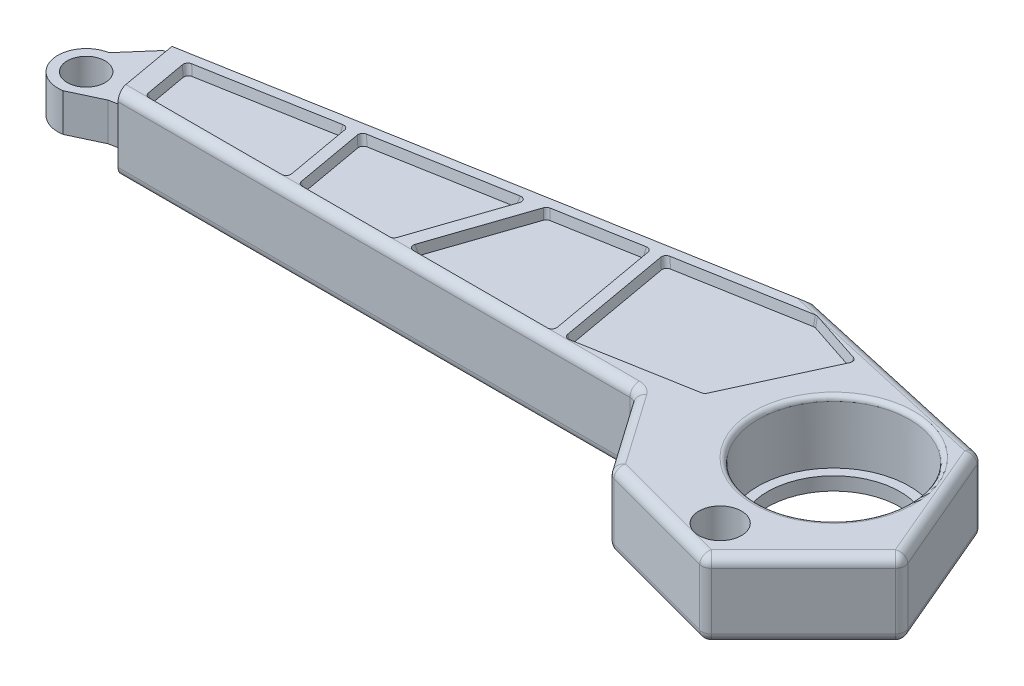
from build123d import *
from OCP.BRepFilletAPI import BRepFilletAPI_MakeChamfer

# Parameters (mm, degrees)
BOSS_EXTRUDE1_DEPTH = 8
SKETCH4_R           = 2.249999999999996
CUT_EXTRUDE1_DEPTH  = 92.98394802222327
FILLET1_R           = 1
FILLET2_R           = 1
FILLET4_R           = 1
SKETCH9_W           = 0.9999999999999964
SKETCH9_H           = 8
CUT_EXTRUDE5_DEPTH  = 0.3
CUT_EXTRUDE6_DEPTH  = 92.80461337567392
BOSS_EXTRUDE2_DEPTH = 5
SKETCH12_R          = 3
BOSS_EXTRUDE3_DEPTH = 4
SKETCH13_R          = 2
CUT_EXTRUDE7_DEPTH  = 92.65198872396041
SKETCH14_R          = 0.4999999999999998
CUT_EXTRUDE8_DEPTH  = 2
CUT_EXTRUDE9_DEPTH  = 92.65198872396041
CUT_EXTRUDE10_DEPTH = 92.65198872396041
CUT_EXTRUDE12_DEPTH = 92.65198872396041
BOSS_EXTRUDE4_DEPTH = 4
BOSS_EXTRUDE5_START = -1
SKETCH20_R          = 2
SKETCH20_R_2        = 1.5
BOSS_EXTRUDE5_DEPTH = 1
SKETCH21_R          = 7.9999999999999964
CUT_EXTRUDE13_DEPTH = 6.6
SKETCH22_R          = 7.000000000000001
CUT_EXTRUDE14_DEPTH = 92.69322241614681
FILLET5_R           = 0.5
CHAMFER1_SIZE       = 3
CUT_EXTRUDE15_DEPTH = 1
CUT_EXTRUDE18_DEPTH = 1
CHAMFER3_SIZE       = 1
CHAMFER3_SIZE_2     = 0.176326981
FILLET6_R           = 0.5
CUT_EXTRUDE16_DEPTH = 1
CUT_EXTRUDE17_DEPTH = 1
CHAMFER4_SIZE       = 1
CHAMFER4_SIZE_2     = 0.176326981
FILLET7_R           = 0.5
FILLET8_R           = 1


# Some blends are built 0.0001 mm under size
with BuildPart() as part:
    # Sketch3 → Boss-Extrude1 (new body)
    with BuildSketch(Plane(origin=(0, 0, 0), x_dir=(1, 0, 0), z_dir=(0, 1, 0))):
        Polygon((0, 0), (60.00000000000001, 0), (65.73576436351047, -8.191520442889912), (79.02230127440997, -11.751637278371739), (89.6289029922082, -1.1450355605735398), (83.7679360648691, 12.662537241213071), (55.20005539838964, 19.071089171004548), (-13.712430259028462, 6.780063155405024), (-15.782982619848628, -0.9473434549075227), (-1.2940952255126068, -4.829629131445341), align=None)
    extrude(amount=BOSS_EXTRUDE1_DEPTH)

    # Sketch4 → Cut-Extrude1 (cut, through all)
    with BuildSketch(Plane(origin=(0, 8, 0), x_dir=(1, 0, 0), z_dir=(0, 1, 0))):
        with Locations(Location((76.77230127440997, -7.7516372783717395, 0), (0, 0, 270))):
            Circle(SKETCH4_R)
    extrude(amount=-CUT_EXTRUDE1_DEPTH, mode=Mode.SUBTRACT)

    # Fillet1
    fillet1_edges = [part.edges().sort_by_distance(p)[0] for p in [
        (83.7679360648691, 4, -12.662537241213071),
        (89.6289029922082, 4, 1.1450355605735398),
        (79.02230127440997, 4, 11.751637278371739),
    ]]
    fillet(fillet1_edges, radius=FILLET1_R)

    # Fillet2
    fillet2_edges = [part.edges().sort_by_distance(p)[0] for p in [
        (65.73576436351047, 4, 8.191520442889912),
        (60.00000000000001, 4, 0),
        (0, 4, 0),
    ]]
    fillet(fillet2_edges, radius=FILLET2_R)

    # Fillet4
    fillet4_edges = [part.edges().sort_by_distance(p)[0] for p in [
        (-13.712430259028462, 4, -6.780063155405024),
    ]]
    fillet(fillet4_edges, radius=FILLET4_R)

    # Sketch9 → Cut-Extrude5 (cut)
    with BuildSketch(Plane(origin=(-1.2940952255126068, 0, 4.829629131445342), x_dir=(0.9659258262890682, 0, 0.2588190451025213), z_dir=(-0.2588190451025213, 0, 0.9659258262890682))):
        Polygon((-14.000000000000002, 8), (-13.000000000000004, 8), (-13.000000000000002, 0), (-14.000000000000002, 0), align=None)
        with Locations((-11.500000000000002, 4)):
            Rectangle(SKETCH9_W, SKETCH9_H)
        Polygon((-10.000000000000002, 8), (-9.000000000000004, 8), (-9.000000000000002, 0), (-10, 0), align=None)
        Polygon((-6.0000000000000036, 8), (-5.000000000000003, 8), (-5.000000000000002, 0), (-6.000000000000002, 0), align=None)
        Polygon((-4.000000000000002, 8), (-3.0000000000000027, 8), (-3.0000000000000018, 0), (-4.000000000000002, 0), align=None)
        Polygon((-2.0000000000000036, 8), (-1.0000000000000027, 8), (-1.0000000000000018, 0), (-2.0000000000000018, 0), align=None)
        Polygon((-8.000000000000004, 8), (-7.000000000000003, 8), (-7.000000000000002, 0), (-8.000000000000002, 0), align=None)
    extrude(amount=-CUT_EXTRUDE5_DEPTH, mode=Mode.SUBTRACT)

    # Sketch10 → Cut-Extrude6 (cut, through all)
    with BuildSketch(Plane(origin=(0, 8, 0), x_dir=(1, 0, 0), z_dir=(0, 1, 0))):
        Polygon((3.6492707822654706, 9.876644524337756), (5.4108397292767005, 0), (6.584389621055377, -6.579779424664859), (-13.988533836457151, -10.790968007498236), (-17.448835921663886, 6.11364895243188), align=None)
    extrude(amount=-CUT_EXTRUDE6_DEPTH, mode=Mode.SUBTRACT)

    # Sketch11 → Boss-Extrude2 (add)
    with BuildSketch(Plane(origin=(5.244020977986171, 0, -0.9353079873971974), x_dir=(0.1755860859371368, 0, 0.9844640808202585), z_dir=(-0.9844640808202585, 0, 0.1755860859371368))):
        Polygon((-9.082440600057861, 6), (0.9500681696968528, 6), (0.9500681696968527, 2), (-9.082440600057861, 2), align=None)
    extrude(amount=BOSS_EXTRUDE2_DEPTH)

    # Sketch12 → Boss-Extrude3 (add)
    with BuildSketch(Plane(origin=(0, 6, 0), x_dir=(1, 0, 0), z_dir=(0, 1, 0))):
        with Locations((-0.03823893263600218, 2.0754618127750915)):
            Circle(SKETCH12_R)
    extrude(amount=-BOSS_EXTRUDE3_DEPTH)

    # Sketch13 → Cut-Extrude7 (cut, through all)
    with BuildSketch(Plane(origin=(0, 6, 0), x_dir=(1, 0, 0), z_dir=(0, 1, 0))):
        with Locations(Location((-0.03823893263600218, 2.0754618127750915, 0), (0, 0, 270))):
            Circle(SKETCH13_R)
    extrude(amount=-CUT_EXTRUDE7_DEPTH, mode=Mode.SUBTRACT)

    # Sketch14 → Cut-Extrude8 (cut)
    with BuildSketch(Plane(origin=(5.244020977986171, 0, -0.9353079873971974), x_dir=(0.1755860859371368, 0, 0.9844640808202585), z_dir=(-0.9844640808202585, 0, 0.1755860859371368))):
        with Locations((-7.78244060005786, 7)):
            Circle(SKETCH14_R)
    extrude(amount=-CUT_EXTRUDE8_DEPTH, mode=Mode.SUBTRACT)

    # Sketch15 → Cut-Extrude9 (cut, through all)
    with BuildSketch(Plane(origin=(0, 6, 0), x_dir=(1, 0, 0), z_dir=(0, 1, 0))):
        Polygon((-0.5649971904474126, 5.028854055235867), (3.6492707822654706, 9.876644524337756), (-1.2730496218358216, 8.998714094652073), align=None)
    extrude(amount=-CUT_EXTRUDE9_DEPTH, mode=Mode.SUBTRACT)

    # Sketch16 → Cut-Extrude10 (cut, through all)
    with BuildSketch(Plane(origin=(0, 6, 0), x_dir=(1, 0, 0), z_dir=(0, 1, 0))):
        Polygon((0.4885193251754081, -0.877930429685684), (5.175598979631719, 1.3189317771661455), (5.4108397292767005, 0), align=None)
    extrude(amount=-CUT_EXTRUDE10_DEPTH, mode=Mode.SUBTRACT)

    # Sketch17 → Cut-Extrude12 (cut, through all)
    with BuildSketch(Plane(origin=(0, 6, 0), x_dir=(1, 0, 0), z_dir=(0, 1, 0))):
        Polygon((3.9126499111711754, 8.399948403107368), (2.081660562423631, 8.073378587709637), (3.6492707822654706, 9.876644524337756), align=None)
    extrude(amount=-CUT_EXTRUDE12_DEPTH, mode=Mode.SUBTRACT)

    # Sketch19 → Boss-Extrude4 (add)
    with BuildSketch(Plane(origin=(0, 6, 0), x_dir=(1, 0, 0), z_dir=(0, 1, 0))):
        Polygon((5.24362235052317, 0.9375429846457439), (3.7216638547456102, 0.6374637069489362), (5.175598979631719, 1.3189317771661455), align=None)
    extrude(amount=-BOSS_EXTRUDE4_DEPTH)

    # Sketch20 → Boss-Extrude5 (add)
    with BuildSketch(Plane.XZ.offset(-2).offset(BOSS_EXTRUDE5_START)):
        with Locations(Location((-0.03823893263600218, -2.0754618127750915, 0), (0, 0, 90))):
            Circle(SKETCH20_R)
        with Locations(Location((-0.03823893263600218, -2.0754618127750915, 0), (0, 0, 270))):
            Circle(SKETCH20_R_2, mode=Mode.SUBTRACT)
    extrude(amount=BOSS_EXTRUDE5_DEPTH)

    # Sketch21 → Cut-Extrude13 (cut)
    with BuildSketch(Plane(origin=(0, 8, 0), x_dir=(1, 0, 0), z_dir=(0, 1, 0))):
        with Locations(Location((76.77230127440997, 4.248362721628261, 0), (0, 0, 270))):
            Circle(SKETCH21_R)
    extrude(amount=-CUT_EXTRUDE13_DEPTH, mode=Mode.SUBTRACT)

    # Sketch22 → Cut-Extrude14 (cut, through all)
    with BuildSketch(Plane(origin=(0, 1.4000000000000001, 0), x_dir=(1, 0, 0), z_dir=(0, 1, 0))):
        with Locations(Location((76.77230127440997, 4.248362721628261, 0), (0, 0, 270))):
            Circle(SKETCH22_R)
    extrude(amount=-CUT_EXTRUDE14_DEPTH, mode=Mode.SUBTRACT)

    # Fillet5
    fillet5_edges = [part.edges().sort_by_distance(p)[0] for p in [
        (76.77230127440997, 8, -12.248362721628258),
    ]]
    fillet(fillet5_edges, radius=FILLET5_R)

    # Chamfer1
    chamfer1_edges = [part.edges().sort_by_distance(p)[0] for p in [
        (29.424663090327552, 0, -14.473866847671154),
        (29.424663090327552, 8, -14.473866847671154),
    ]]
    chamfer(chamfer1_edges, length=CHAMFER1_SIZE)

    # Sketch23 → Cut-Extrude15 (cut)
    with BuildSketch(Plane(origin=(0, 8, 0), x_dir=(1, 3e-17, 0), z_dir=(-3e-17, 1, 6e-17))):
        Polygon((6.320543287654537, 6.289960372931009), (7.264044888923313, 1), (22.264044888923312, 1.0000000000000002), (20.85808618403368, 8.882833293384943), align=None)
    extrude(amount=-CUT_EXTRUDE15_DEPTH, mode=Mode.SUBTRACT)

    # Sketch26 → Cut-Extrude18 (cut)
    with BuildSketch(Plane.XZ):
        Polygon((7.264044888923271, -1.0000000000000144), (22.264044888923273, -1.0000000000000144), (20.85808618403371, -8.882833293384953), (6.320543287654537, -6.2899603729310085), align=None)
    extrude(amount=-CUT_EXTRUDE18_DEPTH, mode=Mode.SUBTRACT)

    # Chamfer3
    chamfer3_edges_1 = [part.edges().sort_by_distance(p)[0] for p in [
        (21.561065536478495, 7.000000000000001, -4.941416646692471),
    ]]
    chamfer3_side_1 = [part.faces().sort_by_distance(p)[0] for p in [
        (21.561065536478495, 7.00352653961417, -4.941416646692471),
    ]]
    chamfer3_edges_2 = [part.edges().sort_by_distance(p)[0] for p in [
        (14.764044888923312, 7.000000000000001, -1),
    ]]
    chamfer3_side_2 = [part.faces().sort_by_distance(p)[0] for p in [
        (14.764044888923312, 7.00352653961417, -1),
    ]]
    chamfer3_edges_3 = [part.edges().sort_by_distance(p)[0] for p in [
        (6.792294088288925, 7, -3.6449801864655047),
    ]]
    chamfer3_side_3 = [part.faces().sort_by_distance(p)[0] for p in [
        (6.792294088288925, 7.003526539614169, -3.6449801864655047),
    ]]
    chamfer3_edges_4 = [part.edges().sort_by_distance(p)[0] for p in [
        (13.589314735844109, 7.000000000000001, -7.586396833157976),
    ]]
    chamfer3_side_4 = [part.faces().sort_by_distance(p)[0] for p in [
        (13.589314735844109, 7.00352653961417, -7.586396833157976),
    ]]
    chamfer3 = BRepFilletAPI_MakeChamfer(part.part.solid().wrapped)
    for e in chamfer3_edges_1:
        chamfer3.Add(CHAMFER3_SIZE - 0.0001, CHAMFER3_SIZE_2 - 0.0001, e.wrapped, chamfer3_side_1[0].wrapped)
    for e in chamfer3_edges_2:
        chamfer3.Add(CHAMFER3_SIZE - 0.0001, CHAMFER3_SIZE_2 - 0.0001, e.wrapped, chamfer3_side_2[0].wrapped)
    for e in chamfer3_edges_3:
        chamfer3.Add(CHAMFER3_SIZE - 0.0001, CHAMFER3_SIZE_2 - 0.0001, e.wrapped, chamfer3_side_3[0].wrapped)
    for e in chamfer3_edges_4:
        chamfer3.Add(CHAMFER3_SIZE - 0.0001, CHAMFER3_SIZE_2 - 0.0001, e.wrapped, chamfer3_side_4[0].wrapped)
    add(Compound.cast(chamfer3.Shape()), mode=Mode.REPLACE)  # a hair under: the kernel refuses the full size

    # Fillet6
    # the kernel refuses this fillet: 0.5 mm, written as the material it adds along each edge
    with BuildSketch(Plane(origin=(6.823821238566845, 10.98261734621967, -0.4743121581151881), x_dir=(-0.19833848791101824, 0.1416565118206084, -0.9698429135030007), z_dir=(0.14383976600970688, -0.97458045428937, -0.1717645476557896))) as fillet6_piece_1_section:
        with BuildLine():
            CenterArc((FILLET6_R * 0.81613712734, FILLET6_R), FILLET6_R, 191.56167759348406, 78.43832240651591)
            Line((-FILLET6_R * 0.163572394541, FILLET6_R * 0.799577314815), (0, 0))
            Line((0, 0), (FILLET6_R * 0.81613712734, 0))
        make_face()
    fillet6_piece_1 = extrude(amount=5.106665580785913, mode=Mode.PRIVATE)
    fillet6_piece_1 = split(fillet6_piece_1, bisect_by=Plane(origin=(6.823821238566845, 8, -0.4743121581151881), z_dir=(0, -1, 0)), keep=Keep.TOP, mode=Mode.PRIVATE)
    add(fillet6_piece_1)
    with BuildSketch(Plane(origin=(5.598690700329794, 11.530560133329704, -6.793292634042218), x_dir=(0.14377807070550067, 0.1684169241381096, 0.9751736286672554), z_dir=(0.1983832161669965, -0.9703140568331037, 0.13832834364411134))) as fillet6_piece_2_section:
        with BuildLine():
            CenterArc((FILLET6_R * 0.970314056833, -FILLET6_R), FILLET6_R, 90.00000000000018, 88.27362489281286)
            Line((-FILLET6_R * 0.0292320410453, -FILLET6_R * 0.969873629224), (0, 0))
            Line((0, 0), (FILLET6_R * 0.970314056833, 0))
        make_face()
    fillet6_piece_2 = extrude(amount=5.882061384401134, mode=Mode.PRIVATE)
    fillet6_piece_2 = split(fillet6_piece_2, bisect_by=Plane(origin=(5.598690700329794, 8, -6.793292634042218), z_dir=(0, -1, 0)), keep=Keep.TOP, mode=Mode.PRIVATE)
    add(fillet6_piece_2)
    with BuildSketch(Plane(origin=(23.140448314746898, 12.164120056491484, -0.2660786790927667), x_dir=(-0.9791885925249815, 0.1998719692365431, 0.03522635636071799), z_dir=(-0.20295245814955268, -0.9643260989611157, -0.16995727284670917))) as fillet6_piece_3_section:
        with BuildLine():
            CenterArc((FILLET6_R * 1.15153855415, FILLET6_R), FILLET6_R, 171.94231973122922, 98.05768026877081)
            Line((FILLET6_R * 0.161411094227, FILLET6_R * 1.14016994363), (0, 0))
            Line((0, 0), (FILLET6_R * 1.15153855415, 0))
        make_face()
    fillet6_piece_3 = extrude(amount=6.794582678737095, mode=Mode.PRIVATE)
    fillet6_piece_3 = split(fillet6_piece_3, bisect_by=Plane(origin=(23.140448314746898, 8, -0.2660786790927667), z_dir=(0, -1, 0)), keep=Keep.TOP, mode=Mode.PRIVATE)
    add(fillet6_piece_3)
    with BuildSketch(Plane(origin=(21.36141844514488, 11.53056013332969, -9.604685880709683), x_dir=(-0.9751736286672563, 0.16841692413810702, 0.1437780707054983), z_dir=(-0.13832834364410923, -0.970314056833104, 0.19838321616699628))) as fillet6_piece_4_section:
        with BuildLine():
            CenterArc((FILLET6_R * 0.970314056833, -FILLET6_R), FILLET6_R, 90.00000000000028, 88.27362489281248)
            Line((-FILLET6_R * 0.0292320410453, -FILLET6_R * 0.969873629224), (0, 0))
            Line((0, 0), (FILLET6_R * 0.970314056833, 1e-17))
        make_face()
    fillet6_piece_4 = extrude(amount=5.8820613844011085, mode=Mode.PRIVATE)
    fillet6_piece_4 = split(fillet6_piece_4, bisect_by=Plane(origin=(21.36141844514488, 8, -9.604685880709683), z_dir=(0, -1, 0)), keep=Keep.TOP, mode=Mode.PRIVATE)
    add(fillet6_piece_4)

    # Sketch24 → Cut-Extrude16 (cut)
    with BuildSketch(Plane(origin=(0, 8, 0), x_dir=(1, 3e-17, 0), z_dir=(-3e-17, 1, 6e-17))):
        Polygon((21.99537218876625, 9.08567624322187), (23.437509358991175, 1.0000000000000144), (33.43750935899117, 1.0000000000000144), (37.09756611667351, 11.779258642546566), align=None)
        Polygon((38.66106910050321, 12.058120385326404), (34.906325886176084, 1.000000000000014), (50.336837418826605, 1.0000000000000144), (48.065381225675125, 13.735445530205476), align=None)
        Polygon((49.20110932225087, 13.938010616176326), (51.508694421764794, 1.0000000000000142), (64.08422154015777, 3.2429336207728054), (69.15274319259933, 14.294082857400431), (62.84910626589879, 16.372226765759397), align=None)
    extrude(amount=-CUT_EXTRUDE16_DEPTH, mode=Mode.SUBTRACT)

    # Sketch25 → Cut-Extrude17 (cut)
    with BuildSketch(Plane.XZ):
        Polygon((23.437509358991175, -1.0000000000000144), (21.99537218876625, -9.08567624322187), (37.09756611667351, -11.779258642546566), (33.43750935899117, -1.0000000000000144), align=None)
        Polygon((34.906325886176084, -1.000000000000014), (38.66106910050321, -12.058120385326404), (48.065381225675125, -13.735445530205476), (50.336837418826605, -1.0000000000000144), align=None)
        Polygon((51.508694421764794, -1.0000000000000142), (49.20110932225087, -13.938010616176326), (62.84910626589879, -16.372226765759397), (69.15274319259933, -14.294082857400431), (64.08422154015777, -3.2429336207728054), align=None)
    extrude(amount=-CUT_EXTRUDE17_DEPTH, mode=Mode.SUBTRACT)

    # Chamfer4
    # the kernel refuses this chamfer: 1, 0.176326981 mm, written as the material it adds along each edge
    with BuildSketch(Plane(origin=(37.93304197923928, 1.000000000000002, -14.239824422926374), x_dir=(5.6e-16, -1, 1.2e-16), z_dir=(-0.32151756353086314, 0, 0.9469036151273146))) as chamfer4_piece_1_section:
        Polygon((CHAMFER4_SIZE, 0), (-1e-16, -CHAMFER4_SIZE_2 * 0.999999998347), (0, 0), align=None)
    chamfer4_piece_1 = extrude(amount=16.580769100976763, mode=Mode.PRIVATE)
    chamfer4_piece_1 = split(chamfer4_piece_1, bisect_by=Plane(origin=(37.93304197923928, 1.000000000000001, -1.0000000000000142), z_dir=(0, 6e-17, -1)), keep=Keep.TOP, mode=Mode.PRIVATE)
    chamfer4_piece_1 = split(chamfer4_piece_1, bisect_by=Plane(origin=(38.33261282146562, 1.0000000000000018, -11.999537900133411), z_dir=(0.1755860859371357, 0, 0.9844640808202587)), keep=Keep.TOP, mode=Mode.PRIVATE)
    add(chamfer4_piece_1)
    with BuildSketch(Plane(origin=(21.99537218876625, 1.000000000000001, -9.08567624322187), x_dir=(-1.6e-16, -1, -1.11e-15), z_dir=(0.9844640808202587, 0, -0.1755860859371357))) as chamfer4_piece_2:
        Polygon((CHAMFER4_SIZE, 0), (-2e-16, -CHAMFER4_SIZE_2 * 0.999999998347), (0, 0), align=None)
    extrude(amount=17.93906185067429)
    with BuildSketch(Plane(origin=(23.89377661541057, 1.0000000000000007, 1.5581681076945575), x_dir=(-1e-17, -1, -5e-17), z_dir=(-0.17558608593713568, 0, -0.9844640808202587))) as chamfer4_piece_3_section:
        Polygon((CHAMFER4_SIZE, 0), (-2.2e-16, -CHAMFER4_SIZE_2 * 0.999999998347), (0, 0), align=None)
    chamfer4_piece_3 = extrude(amount=10.811815848119053, mode=Mode.PRIVATE)
    chamfer4_piece_3 = split(chamfer4_piece_3, bisect_by=Plane(origin=(23.89377661541057, 1.0000000000000009, -1.0000000000000142), z_dir=(0, 6e-17, -1)), keep=Keep.TOP, mode=Mode.PRIVATE)
    add(chamfer4_piece_3)
    with BuildSketch(Plane(origin=(36.03604815541237, 1.000000000000001, -1.0000000000000144), x_dir=(3e-17, -1, 0), z_dir=(-1, -3e-17, 0))) as chamfer4_piece_4_section:
        Polygon((CHAMFER4_SIZE, 0), (-2.2e-16, -CHAMFER4_SIZE_2 * 0.999999998347), (0, 0), align=None)
    chamfer4_piece_4 = extrude(amount=15.197077592842383, mode=Mode.PRIVATE)
    chamfer4_piece_4 = split(chamfer4_piece_4, bisect_by=Plane(origin=(23.82592827643436, 1.0000000000000007, 1.1777606721685763), z_dir=(0.9844640808202587, 0, -0.17558608593713568)), keep=Keep.TOP, mode=Mode.PRIVATE)
    add(chamfer4_piece_4)
    with BuildSketch(Plane(origin=(48.065381225675125, 1.0000000000000022, -13.735445530205476), x_dir=(-3.2e-16, -1, 0), z_dir=(0.1755860859371348, 0, 0.9844640808202588))) as chamfer4_piece_5_section:
        Polygon((CHAMFER4_SIZE, 0), (5e-17, -CHAMFER4_SIZE_2 * 0.999999998347), (0, 0), align=None)
    chamfer4_piece_5 = extrude(amount=15.534963576484518, mode=Mode.PRIVATE)
    chamfer4_piece_5 = split(chamfer4_piece_5, bisect_by=Plane(origin=(48.065381225675125, 1.0000000000000013, -1.0000000000000142), z_dir=(-3e-17, 6e-17, -1)), keep=Keep.TOP, mode=Mode.PRIVATE)
    add(chamfer4_piece_5)
    with BuildSketch(Plane(origin=(36.10290099280864, 1.0000000000000018, -11.601853128907011), x_dir=(-2.7e-16, -1, -1.73e-15), z_dir=(0.9844640808202587, 0, -0.17558608593713573))) as chamfer4_piece_6:
        Polygon((CHAMFER4_SIZE, 0), (-5.3e-16, -CHAMFER4_SIZE_2 * 0.999999998347), (0, 0), align=None)
    extrude(amount=14.74980004192982)
    with BuildSketch(Plane(origin=(34.07085002361032, 1.0000000000000009, 1.4605657803797945), x_dir=(2e-17, -1, -6e-17), z_dir=(0.3215175635308632, 0, -0.9469036151273146))) as chamfer4_piece_7_section:
        Polygon((CHAMFER4_SIZE, 0), (0, -CHAMFER4_SIZE_2 * 0.999999998347), (0, 0), align=None)
    chamfer4_piece_7 = extrude(amount=16.8752676521755, mode=Mode.PRIVATE)
    chamfer4_piece_7 = split(chamfer4_piece_7, bisect_by=Plane(origin=(34.07085002361032, 1.000000000000001, -1.0000000000000142), z_dir=(-3e-17, 6e-17, -1)), keep=Keep.TOP, mode=Mode.PRIVATE)
    chamfer4_piece_7 = split(chamfer4_piece_7, bisect_by=Plane(origin=(31.875552966284328, 1.0000000000000016, -10.847875905834513), z_dir=(0.17558608593713573, 0, 0.9844640808202587)), keep=Keep.TOP, mode=Mode.PRIVATE)
    add(chamfer4_piece_7)
    with BuildSketch(Plane(origin=(52.9353762152478, 1.0000000000000016, -1.0000000000000144), x_dir=(3e-17, -1, 0), z_dir=(-1, -3e-17, 3e-17))) as chamfer4_piece_8:
        Polygon((CHAMFER4_SIZE, 0), (-2.2e-16, -CHAMFER4_SIZE_2 * 0.999999998347), (0, 0), align=None)
    extrude(amount=20.627589125492904)
    with BuildSketch(Plane(origin=(70.23603916326972, 1.000000000000003, -16.65604681064684), x_dir=(2.72e-15, -1, 1.17e-15), z_dir=(-0.4168865872475517, 0, 0.908958510259456))) as chamfer4_piece_9_section:
        Polygon((CHAMFER4_SIZE, 0), (-5.2e-16, -CHAMFER4_SIZE_2 * 0.999999998347), (0, 0), align=None)
    chamfer4_piece_9 = extrude(amount=17.35511243369904, mode=Mode.PRIVATE)
    chamfer4_piece_9 = split(chamfer4_piece_9, bisect_by=Plane(origin=(69.42749968544916, 1.0000000000000029, -14.203502841682932), z_dir=(-0.31309806142880964, 0, 0.9497208031466519)), keep=Keep.TOP, mode=Mode.PRIVATE)
    add(chamfer4_piece_9)
    with BuildSketch(Plane(origin=(60.38121991315392, 1.0000000000000029, -17.185824225466426), x_dir=(1e-17, -1, 0), z_dir=(0.9497208031466519, 0, 0.31309806142880964))) as chamfer4_piece_10_section:
        Polygon((CHAMFER4_SIZE, 0), (0, -CHAMFER4_SIZE_2 * 0.999999998347), (0, 0), align=None)
    chamfer4_piece_10 = extrude(amount=11.8344355466906, mode=Mode.PRIVATE)
    chamfer4_piece_10 = split(chamfer4_piece_10, bisect_by=Plane(origin=(60.597943006232605, 1.0000000000000029, -15.970715981088688), z_dir=(0.1755860859371356, 0, 0.9844640808202587)), keep=Keep.TOP, mode=Mode.PRIVATE)
    add(chamfer4_piece_10)
    with BuildSketch(Plane(origin=(46.6429412145563, 1.0000000000000022, -13.481743359756933), x_dir=(-1.8e-16, -1, -1.24e-15), z_dir=(0.9844640808202587, 0, -0.1755860859371356))) as chamfer4_piece_11_section:
        Polygon((CHAMFER4_SIZE, 0), (-2.2e-16, -CHAMFER4_SIZE_2 * 0.999999998347), (0, 0), align=None)
    chamfer4_piece_11 = extrude(amount=19.060454845038695, mode=Mode.PRIVATE)
    chamfer4_piece_11 = split(chamfer4_piece_11, bisect_by=Plane(origin=(49.091139832305146, 1.0000000000000027, -20.907867772346513), z_dir=(-0.31309806142880964, 0, 0.9497208031466519)), keep=Keep.TOP, mode=Mode.PRIVATE)
    add(chamfer4_piece_11)
    with BuildSketch(Plane(origin=(51.508694421764794, 1.0000000000000016, -1.0000000000000142), x_dir=(3e-16, -1, -1.1e-16), z_dir=(-0.17558608593713498, 0, -0.9844640808202588))) as chamfer4_piece_12:
        Polygon((CHAMFER4_SIZE, 0), (5e-17, -CHAMFER4_SIZE_2 * 0.999999998347), (0, 0), align=None)
    extrude(amount=13.142186564487266)
    with BuildSketch(Plane(origin=(66.64238964785234, 1.0000000000000022, -3.6992008771922005), x_dir=(2.7e-16, -1, 1.28e-15), z_dir=(-0.9844640808202586, 0, 0.17558608593713657))) as chamfer4_piece_13:
        Polygon((CHAMFER4_SIZE, 0), (-2.3e-16, -CHAMFER4_SIZE_2 * 0.999999998347), (0, 0), align=None)
    extrude(amount=17.971060273769666)
    with BuildSketch(Plane(origin=(49.20110932225087, 7.000000000000003, -13.938010616176326), x_dir=(1e-17, 1, 5e-17), z_dir=(0.17558608593713498, 0, 0.9844640808202588))) as chamfer4_piece_14:
        Polygon((CHAMFER4_SIZE, 0), (8.9e-16, -CHAMFER4_SIZE_2 * 0.999999998347), (0, 0), align=None)
    extrude(amount=13.142186564487266)
    with BuildSketch(Plane(origin=(65.40727437359337, 7.000000000000003, -16.82849402217879), x_dir=(-4e-17, 1, 1e-17), z_dir=(-0.9844640808202587, 0, 0.1755860859371356))) as chamfer4_piece_15_section:
        Polygon((CHAMFER4_SIZE, 0), (0, -CHAMFER4_SIZE_2 * 0.999999998347), (0, 0), align=None)
    chamfer4_piece_15 = extrude(amount=19.060454845038695, mode=Mode.PRIVATE)
    chamfer4_piece_15 = split(chamfer4_piece_15, bisect_by=Plane(origin=(65.0208224520323, 7.000000000000003, -15.656268848865189), z_dir=(-0.31309806142880964, 0, 0.9497208031466519)), keep=Keep.TOP, mode=Mode.PRIVATE)
    add(chamfer4_piece_15)
    with BuildSketch(Plane(origin=(71.6206295453442, 7.000000000000003, -13.480485397693403), x_dir=(-5.4e-16, 1, 1.6e-15), z_dir=(-0.9497208031466519, 0, -0.31309806142880964))) as chamfer4_piece_16_section:
        Polygon((CHAMFER4_SIZE, 0), (3e-16, -CHAMFER4_SIZE_2 * 0.999999998347), (0, 0), align=None)
    chamfer4_piece_16 = extrude(amount=11.8344355466906, mode=Mode.PRIVATE)
    chamfer4_piece_16 = split(chamfer4_piece_16, bisect_by=Plane(origin=(70.85033813625287, 7.000000000000003, -17.79930268875333), z_dir=(0.1755860859371356, 0, 0.9844640808202587)), keep=Keep.TOP, mode=Mode.PRIVATE)
    add(chamfer4_piece_16)
    with BuildSketch(Plane(origin=(63.00092556948738, 7.000000000000002, -0.8809696675263954), x_dir=(2.66e-15, 1, 1.3e-15), z_dir=(0.4168865872475517, 0, -0.908958510259456))) as chamfer4_piece_17_section:
        Polygon((CHAMFER4_SIZE, 0), (-5.2e-16, -CHAMFER4_SIZE_2 * 0.999999998347), (0, 0), align=None)
    chamfer4_piece_17 = extrude(amount=17.355112433699045, mode=Mode.PRIVATE)
    chamfer4_piece_17 = split(chamfer4_piece_17, bisect_by=Plane(origin=(67.59245691761946, 7.000000000000003, -14.80846835506626), z_dir=(-0.31309806142880964, 0, 0.9497208031466519)), keep=Keep.TOP, mode=Mode.PRIVATE)
    add(chamfer4_piece_17)
    with BuildSketch(Plane(origin=(48.950526314070224, 7.000000000000002, -0.5437327435806192), x_dir=(4e-17, 1, 4.4e-16), z_dir=(0.9844640808202586, 0, -0.17558608593713657))) as chamfer4_piece_18:
        Polygon((CHAMFER4_SIZE, 0), (8.1e-16, -CHAMFER4_SIZE_2 * 0.999999998347), (0, 0), align=None)
    extrude(amount=17.971060273769666)
    with BuildSketch(Plane(origin=(32.30778708975489, 7.000000000000001, -1.000000000000014), x_dir=(-3e-17, 1, 0), z_dir=(1, 3e-17, -3e-17))) as chamfer4_piece_19:
        Polygon((CHAMFER4_SIZE, 0), (0, -CHAMFER4_SIZE_2 * 0.999999998347), (0, 0), align=None)
    extrude(amount=20.62758912549291)
    with BuildSketch(Plane(origin=(39.49654496306898, 7.000000000000002, -14.518686165706217), x_dir=(5.27e-15, 1, 1.86e-15), z_dir=(-0.3215175635308632, 0, 0.9469036151273146))) as chamfer4_piece_20_section:
        Polygon((CHAMFER4_SIZE, 0), (9.8e-16, -CHAMFER4_SIZE_2 * 0.999999998347), (0, 0), align=None)
    chamfer4_piece_20 = extrude(amount=16.875267652175513, mode=Mode.PRIVATE)
    chamfer4_piece_20 = split(chamfer4_piece_20, bisect_by=Plane(origin=(39.49654496306898, 7.000000000000001, -1.0000000000000142), z_dir=(-3e-17, 6e-17, -1)), keep=Keep.TOP, mode=Mode.PRIVATE)
    chamfer4_piece_20 = split(chamfer4_piece_20, bisect_by=Plane(origin=(39.89611580529532, 7.000000000000002, -12.27839964291325), z_dir=(0.17558608593713573, 0, 0.9844640808202587)), keep=Keep.TOP, mode=Mode.PRIVATE)
    add(chamfer4_piece_20)
    with BuildSketch(Plane(origin=(50.623549333369695, 7.000000000000003, -14.19171278662487), x_dir=(-4e-17, 1, 1e-17), z_dir=(-0.9844640808202587, 0, 0.17558608593713573))) as chamfer4_piece_21:
        Polygon((CHAMFER4_SIZE, 0), (0, -CHAMFER4_SIZE_2 * 0.999999998347), (0, 0), align=None)
    extrude(amount=14.74980004192982)
    with BuildSketch(Plane(origin=(50.79310467524599, 7.000000000000002, 1.5581681076945548), x_dir=(-1.4e-16, 1, 8e-17), z_dir=(-0.1755860859371348, 0, -0.9844640808202588))) as chamfer4_piece_22_section:
        Polygon((CHAMFER4_SIZE, 0), (3e-17, -CHAMFER4_SIZE_2 * 0.999999998347), (0, 0), align=None)
    chamfer4_piece_22 = extrude(amount=15.534963576484516, mode=Mode.PRIVATE)
    chamfer4_piece_22 = split(chamfer4_piece_22, bisect_by=Plane(origin=(50.79310467524599, 7.000000000000002, -1.0000000000000142), z_dir=(-3e-17, 6e-17, -1)), keep=Keep.TOP, mode=Mode.PRIVATE)
    add(chamfer4_piece_22)
    with BuildSketch(Plane(origin=(20.838970562569983, 7.000000000000001, -1.0000000000000144), x_dir=(-3e-17, 1, 0), z_dir=(1, 3e-17, 0))) as chamfer4_piece_23:
        Polygon((CHAMFER4_SIZE, 0), (0, -CHAMFER4_SIZE_2 * 0.999999998347), (0, 0), align=None)
    extrude(amount=15.197077592842376)
    with BuildSketch(Plane(origin=(21.99537218876625, 7.000000000000001, -9.08567624322187), x_dir=(3.2e-16, 1, 0), z_dir=(0.17558608593713568, 0, 0.9844640808202587))) as chamfer4_piece_24_section:
        Polygon((CHAMFER4_SIZE, 0), (5e-17, -CHAMFER4_SIZE_2 * 0.999999998347), (0, 0), align=None)
    chamfer4_piece_24 = extrude(amount=10.811815848119046, mode=Mode.PRIVATE)
    chamfer4_piece_24 = split(chamfer4_piece_24, bisect_by=Plane(origin=(21.99537218876625, 7, -1.0000000000000142), z_dir=(0, 6e-17, -1)), keep=Keep.TOP, mode=Mode.PRIVATE)
    add(chamfer4_piece_24)
    with BuildSketch(Plane(origin=(39.65573422436809, 7.000000000000002, -12.23552589896596), x_dir=(-4e-17, 1, 1e-17), z_dir=(-0.9844640808202587, 0, 0.1755860859371357))) as chamfer4_piece_25:
        Polygon((CHAMFER4_SIZE, 0), (-8.9e-16, -CHAMFER4_SIZE_2 * 0.999999998347), (0, 0), align=None)
    extrude(amount=20.5376006470955)
    with BuildSketch(Plane(origin=(32.602033496425406, 7.000000000000001, 1.4605657803797953), x_dir=(-2.9e-16, 1, -3e-17), z_dir=(0.32151756353086314, 0, -0.9469036151273146))) as chamfer4_piece_26_section:
        Polygon((CHAMFER4_SIZE, 0), (-8.4e-16, -CHAMFER4_SIZE_2 * 0.999999998347), (0, 0), align=None)
    chamfer4_piece_26 = extrude(amount=16.580769100976767, mode=Mode.PRIVATE)
    chamfer4_piece_26 = split(chamfer4_piece_26, bisect_by=Plane(origin=(32.602033496425406, 7.000000000000001, -1.0000000000000142), z_dir=(0, 6e-17, -1)), keep=Keep.TOP, mode=Mode.PRIVATE)
    chamfer4_piece_26 = split(chamfer4_piece_26, bisect_by=Plane(origin=(30.452020748226907, 7.000000000000002, -10.593978932604317), z_dir=(0.1755860859371357, 0, 0.9844640808202587)), keep=Keep.TOP, mode=Mode.PRIVATE)
    add(chamfer4_piece_26)

    # Fillet7
    fillet7_edges = [part.edges().sort_by_distance(p)[0] for p in [
        (6.320543287654537, 0.5000000000000006, -6.2899603729310085),
        (7.264044888923271, 0.5000000000000003, -1.0000000000000144),
        (22.264044888923273, 0.5000000000000008, -1.0000000000000144),
        (20.85808618403371, 0.5000000000000012, -8.882833293384953),
        (22.097646260454873, 0.5, -9.014362735922603),
        (23.511339587617115, 0.5000000000000002, -1.088163490354266),
        (36.96608863940582, 0.4999999999999998, -11.666253904085144),
        (33.374337797714055, 0.5000000000000003, -1.0881634903542645),
        (38.72781011178511, 0.4999999999999999, -11.980469307036762),
        (35.029368611015684, 0.5000000000000004, -1.0881634903542663),
        (47.99406771837546, 0.49999999999999967, -13.63317145851694),
        (50.231558034267344, 0.5, -1.088163490354265),
        (49.30338339393979, 0.5000000000000006, -13.86669710887567),
        (62.842657543598825, 0.5000000000000011, -16.281521784233675),
        (51.580007929064436, 0.5000000000000001, -1.1022740716886346),
        (69.03150459764858, 0.49999999999999933, -14.241221088826414),
        (64.02331924241719, 0.5000000000000002, -3.321626074645748),
        (69.03150459765847, 7.5, -14.241221088823979),
        (62.84265754359676, 7.499999999999999, -16.28152178423517),
        (64.02331924242866, 7.500000000000001, -3.3216260746467308),
        (49.30338339393827, 7.499999999999999, -13.866697108876872),
        (51.58000792906336, 7.5, -1.1022740716873762),
        (38.72781011178199, 7.5, -11.980469307038712),
        (47.99406771837667, 7.5, -13.63317145851863),
        (35.02936861101192, 7.5, -1.0881634903542636),
        (50.23155803426886, 7.5, -1.0881634903542658),
        (22.097646260453118, 7.500000000000001, -9.014362735923777),
        (36.96608863941081, 7.5, -11.666253904088546),
        (23.51133958761557, 7.5, -1.0881634903542645),
        (33.37433779771791, 7.5, -1.0881634903542658),
    ]]
    fillet(fillet7_edges, radius=FILLET7_R)

    # Fillet8
    # the kernel refuses this fillet: 1 mm, written as the material it takes off along each edge
    with BuildSketch(Plane(origin=(83.26693874447433, 8, -12.774924554150974), x_dir=(-0.21888727412066522, 0, 0.975750153076096), z_dir=(-0.975750153076096, 0, -0.21888727412066525))) as fillet8_piece_1:
        with BuildLine():
            CenterArc((FILLET8_R, -FILLET8_R), FILLET8_R, 90, 90)
            Line((-1.73e-15, -FILLET8_R), (0, 0))
            Line((0, 0), (FILLET8_R, 0))
        make_face()
    extrude(amount=25.258766745611716, mode=Mode.SUBTRACT)
    with BuildSketch(Plane(origin=(83.04805147035367, 8, -11.799174401074882), x_dir=(0.920504853452439, 0, -0.3907311284892771), z_dir=(0.3907311284892771, 0, 0.920504853452439))) as fillet8_piece_2:
        with BuildLine():
            CenterArc((1.0000000000000038 - FILLET8_R, -FILLET8_R), FILLET8_R, 0, 90)
            Line((1.0000000000000038, -FILLET8_R), (1.0000000000000038, 0))
            Line((1.0000000000000038, 0), (1.0000000000000038 - FILLET8_R, 0))
        make_face()
    revolve(axis=Axis((83.04805147035367, 8, -11.799174401074882), (0, 1, 0)), revolution_arc=54.35631433569039, mode=Mode.SUBTRACT)
    with BuildSketch(Plane(origin=(89.36535151824673, 8, 0.5241471971250755), x_dir=(-0.9205048534524407, 0, 0.3907311284892728), z_dir=(-0.3907311284892729, 0, -0.9205048534524408))) as fillet8_piece_3:
        with BuildLine():
            CenterArc((FILLET8_R, -FILLET8_R), FILLET8_R, 90, 90)
            Line((-2.08e-15, -FILLET8_R), (0, 0))
            Line((0, 0), (FILLET8_R, 0))
        make_face()
    extrude(amount=13.812043118516943, mode=Mode.SUBTRACT)
    with BuildSketch(Plane(origin=(88.44484666479428, 8, 0.9148783256143477), x_dir=(0.7071067811865517, 0, 0.7071067811865436), z_dir=(-0.7071067811865436, 0, 0.7071067811865517))) as fillet8_piece_4:
        with BuildLine():
            CenterArc((1.000000000000005 - FILLET8_R, -FILLET8_R), FILLET8_R, 0, 90)
            Line((1.0000000000000095, -FILLET8_R), (1.000000000000005, 0))
            Line((1.000000000000005, 0), (1.000000000000005 - FILLET8_R, 0))
        make_face()
    revolve(axis=Axis((88.44484666479428, 8, 0.9148783256143477), (0, 1, 0)), revolution_arc=67.99999999999972, mode=Mode.SUBTRACT)
    with BuildSketch(Plane(origin=(79.43054956487384, 8, 11.34338898790787), x_dir=(-0.7071067811865467, 0, -0.7071067811865485), z_dir=(0.7071067811865485, 0, -0.7071067811865466))) as fillet8_piece_5:
        with BuildLine():
            CenterArc((FILLET8_R, -FILLET8_R), FILLET8_R, 90, 90)
            Line((1.26e-15, -FILLET8_R), (0, 0))
            Line((0, 0), (FILLET8_R, 0))
        make_face()
    extrude(amount=13.74814121396794, mode=Mode.SUBTRACT)
    with BuildSketch(Plane(origin=(78.72344278368729, 8, 10.636282206721328), x_dir=(-0.2588190451025125, 0, 0.9659258262890704), z_dir=(-0.9659258262890704, 0, -0.2588190451025125))) as fillet8_piece_6:
        with BuildLine():
            CenterArc((0.9999999999999991 - FILLET8_R, -FILLET8_R), FILLET8_R, 0, 90)
            Line((0.9999999999999991, -FILLET8_R), (0.9999999999999991, 0))
            Line((0.9999999999999991, 0), (0.9999999999999991 - FILLET8_R, 0))
        make_face()
    revolve(axis=Axis((78.72344278368729, 8, 10.636282206721328), (0, 1, 0)), revolution_arc=59.99999999999988, mode=Mode.SUBTRACT)
    with BuildSketch(Plane(origin=(66.08733261278867, 8, 8.285722871368428), x_dir=(0.2588190451025209, 0, -0.9659258262890682), z_dir=(0.9659258262890683, 0, 0.2588190451025209))) as fillet8_piece_7:
        with BuildLine():
            CenterArc((FILLET8_R, -FILLET8_R), FILLET8_R, 90, 90)
            Line((1.72e-15, -FILLET8_R), (0, 0))
            Line((0, 0), (FILLET8_R, 0))
        make_face()
    extrude(amount=12.813914680537795, mode=Mode.SUBTRACT)
    with BuildSketch(Plane(origin=(66.3461516578912, 8, 7.319797045079368), x_dir=(-0.2588190451025269, 0, 0.9659258262890666), z_dir=(0.9659258262890666, 0, 0.2588190451025269))) as fillet8_piece_8:
        with BuildLine():
            CenterArc((0.9999999999999986 - FILLET8_R, FILLET8_R), FILLET8_R, 270, 90)
            Line((0.9999999999999986, FILLET8_R), (0.9999999999999986, 0))
            Line((0.9999999999999986, 0), (0.9999999999999986 - FILLET8_R, 0))
        make_face()
    revolve(axis=Axis((66.3461516578912, 8, 7.319797045079368), (0, -1, 0)), revolution_arc=39.999999999999396, mode=Mode.SUBTRACT)
    with BuildSketch(Plane(origin=(60.29858499373725, 8, 0.42642356364895484), x_dir=(0.8191520442889916, 0, -0.5735764363510465), z_dir=(0.5735764363510465, 0, 0.8191520442889916))) as fillet8_piece_9:
        with BuildLine():
            CenterArc((FILLET8_R, -FILLET8_R), FILLET8_R, 90, 90)
            Line((0, -FILLET8_R), (0, 0))
            Line((0, 0), (FILLET8_R, 0))
        make_face()
    extrude(amount=9.115462715182046, mode=Mode.SUBTRACT)
    with BuildSketch(Plane(origin=(59.47943294944827, 8, 1), x_dir=(0.8191520442889899, 0, -0.5735764363510487), z_dir=(0.5735764363510487, 0, 0.8191520442889899))) as fillet8_piece_10:
        with BuildLine():
            CenterArc((1.0000000000000018 + FILLET8_R, -FILLET8_R), FILLET8_R, 90, 90)
            Line((1.000000000000001, -FILLET8_R), (1.0000000000000018, 0))
            Line((1.0000000000000018, 0), (1.0000000000000018 + FILLET8_R, 0))
        make_face()
    revolve(axis=Axis((59.47943294944827, 8, 1), (0, 1, 0)), revolution_arc=54.99999999999976, mode=Mode.SUBTRACT)
    with BuildSketch(Plane(origin=(83.26693874447433, 0, -12.774924554150974), x_dir=(3.8e-16, 1, -1.69e-15), z_dir=(-0.975750153076096, 0, -0.21888727412066525))) as fillet8_piece_11:
        with BuildLine():
            CenterArc((FILLET8_R, -FILLET8_R), FILLET8_R, 89.9999999999999, 90.00000000000001)
            Line((-1.84e-15, -FILLET8_R), (0, 0))
            Line((0, 0), (FILLET8_R, 0))
        make_face()
    extrude(amount=25.258766745611716, mode=Mode.SUBTRACT)
    with BuildSketch(Plane(origin=(83.04805147035367, 0, -11.799174401074882), x_dir=(0.920504853452439, 0, -0.3907311284892771), z_dir=(0.3907311284892771, 0, 0.920504853452439))) as fillet8_piece_12:
        with BuildLine():
            CenterArc((1.0000000000000038 - FILLET8_R, FILLET8_R), FILLET8_R, 270.00000000000006, 89.99999999999994)
            Line((1.0000000000000038 - FILLET8_R, -1.1e-16), (1.0000000000000038, 0))
            Line((1.0000000000000038, 0), (1.000000000000003, FILLET8_R))
        make_face()
    revolve(axis=Axis((83.04805147035367, 0, -11.799174401074882), (0, 1, 0)), revolution_arc=54.35631433569039, mode=Mode.SUBTRACT)
    with BuildSketch(Plane(origin=(89.36535151824673, 0, 0.5241471971250755), x_dir=(2.24e-15, 1, -9.5e-16), z_dir=(-0.3907311284892729, 0, -0.9205048534524408))) as fillet8_piece_13:
        with BuildLine():
            CenterArc((FILLET8_R, -FILLET8_R), FILLET8_R, 89.99999999999986, 90.00000000000011)
            Line((-2.54e-15, -FILLET8_R), (0, 0))
            Line((0, 0), (FILLET8_R, 0))
        make_face()
    extrude(amount=13.812043118516943, mode=Mode.SUBTRACT)
    with BuildSketch(Plane(origin=(88.44484666479428, 0, 0.9148783256143477), x_dir=(0.7071067811865517, 0, 0.7071067811865436), z_dir=(-0.7071067811865436, 0, 0.7071067811865517))) as fillet8_piece_14:
        with BuildLine():
            CenterArc((1.000000000000005 - FILLET8_R, FILLET8_R), FILLET8_R, 270.0000000000008, 89.9999999999992)
            Line((1.000000000000005 - FILLET8_R, -1.1e-16), (1.000000000000005, 0))
            Line((1.000000000000005, 0), (0.9999999999999925, FILLET8_R))
        make_face()
    revolve(axis=Axis((88.44484666479428, 0, 0.9148783256143477), (0, 1, 0)), revolution_arc=67.99999999999972, mode=Mode.SUBTRACT)
    with BuildSketch(Plane(origin=(79.43054956487384, 0, 11.34338898790787), x_dir=(8.9e-16, 1, 8.9e-16), z_dir=(0.7071067811865485, 0, -0.7071067811865466))) as fillet8_piece_15:
        with BuildLine():
            CenterArc((FILLET8_R, -FILLET8_R), FILLET8_R, 89.99999999999993, 90.00000000000017)
            Line((-1.37e-15, -FILLET8_R), (0, 0))
            Line((0, 0), (FILLET8_R, 0))
        make_face()
    extrude(amount=13.74814121396794, mode=Mode.SUBTRACT)
    with BuildSketch(Plane(origin=(78.72344278368729, 0, 10.636282206721328), x_dir=(-0.2588190451025125, 0, 0.9659258262890704), z_dir=(-0.9659258262890704, 0, -0.2588190451025125))) as fillet8_piece_16:
        with BuildLine():
            CenterArc((0.9999999999999991 - FILLET8_R, FILLET8_R), FILLET8_R, 269.9999999999999, 90.00000000000011)
            Line((0.9999999999999991 - FILLET8_R, -1.1e-16), (0.9999999999999991, 0))
            Line((0.9999999999999991, 0), (0.9999999999999991, FILLET8_R))
        make_face()
    revolve(axis=Axis((78.72344278368729, 0, 10.636282206721328), (0, 1, 0)), revolution_arc=59.99999999999988, mode=Mode.SUBTRACT)
    with BuildSketch(Plane(origin=(66.08733261278867, 0, 8.285722871368428), x_dir=(4.4e-16, 1, -1.66e-15), z_dir=(0.9659258262890683, 0, 0.2588190451025209))) as fillet8_piece_17:
        with BuildLine():
            CenterArc((FILLET8_R, -FILLET8_R), FILLET8_R, 90.0000000000001, 90)
            Line((1.6e-15, -FILLET8_R), (0, 0))
            Line((0, 0), (FILLET8_R, 0))
        make_face()
    extrude(amount=12.813914680537795, mode=Mode.SUBTRACT)
    with BuildSketch(Plane(origin=(66.3461516578912, 0, 7.319797045079368), x_dir=(-0.2588190451025269, 0, 0.9659258262890666), z_dir=(0.9659258262890666, 0, 0.2588190451025269))) as fillet8_piece_18:
        with BuildLine():
            CenterArc((0.9999999999999986 - FILLET8_R, -FILLET8_R), FILLET8_R, 0, 90)
            Line((0.9999999999999986 - FILLET8_R, 1.1e-16), (0.9999999999999986, 0))
            Line((0.9999999999999986, 0), (0.9999999999999986, -FILLET8_R))
        make_face()
    revolve(axis=Axis((66.3461516578912, 0, 7.319797045079368), (0, -1, 0)), revolution_arc=39.999999999999396, mode=Mode.SUBTRACT)
    with BuildSketch(Plane(origin=(60.29858499373725, 0, 0.42642356364895484), x_dir=(0, 1, 0), z_dir=(0.5735764363510465, 0, 0.8191520442889916))) as fillet8_piece_19:
        with BuildLine():
            CenterArc((FILLET8_R, -FILLET8_R), FILLET8_R, 90, 90)
            Line((-1.1e-16, -FILLET8_R), (0, 0))
            Line((0, 0), (FILLET8_R, 0))
        make_face()
    extrude(amount=9.115462715182046, mode=Mode.SUBTRACT)
    with BuildSketch(Plane(origin=(59.47943294944827, 0, 1), x_dir=(0.8191520442889899, 0, -0.5735764363510487), z_dir=(0.5735764363510487, 0, 0.8191520442889899))) as fillet8_piece_20:
        with BuildLine():
            CenterArc((1.0000000000000018 + FILLET8_R, FILLET8_R), FILLET8_R, 180, 90)
            Line((1.0000000000000018 + FILLET8_R, -1.1e-16), (1.0000000000000018, 0))
            Line((1.0000000000000018, 0), (0.9999999999999948, FILLET8_R))
        make_face()
    revolve(axis=Axis((59.47943294944827, 0, 1), (0, 1, 0)), revolution_arc=54.99999999999976, mode=Mode.SUBTRACT)
    with BuildSketch(Plane(origin=(2.9108397292767023, 8, 0), x_dir=(0, 0, -1), z_dir=(1, 0, 0))) as fillet8_piece_21:
        with BuildLine():
            CenterArc((FILLET8_R, -FILLET8_R), FILLET8_R, 90, 90)
            Line((0, -FILLET8_R), (0, 0))
            Line((0, 0), (FILLET8_R, 0))
        make_face()
    extrude(amount=56.568593220171564, mode=Mode.SUBTRACT)
    with BuildSketch(Plane(origin=(2.9108397292767023, 0, 0), x_dir=(0, 1, 0), z_dir=(1, 0, 0))) as fillet8_piece_22:
        with BuildLine():
            CenterArc((FILLET8_R, -FILLET8_R), FILLET8_R, 90, 90)
            Line((-1.1e-16, -FILLET8_R), (0, 0))
            Line((0, 0), (FILLET8_R, 0))
        make_face()
    extrude(amount=56.568593220171564, mode=Mode.SUBTRACT)


solid = part.part
